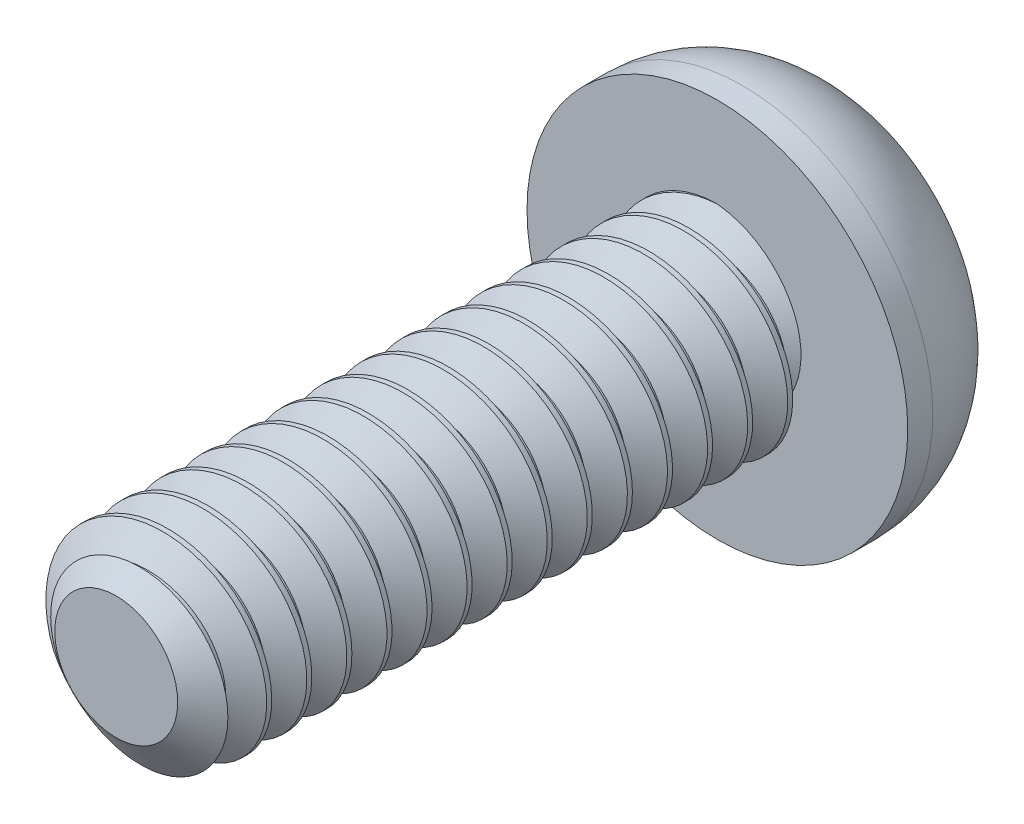
from build123d import *

# Parameters (mm, degrees)
SKETCH1_R          = 2
EXTRUDE1_DEPTH     = 12
CUT_SWEEP1_PITCH   = 0.8
SKETCH6_R          = 3.8
EXTRUDE2_DEPTH     = 2.75
CUT_EXTRUDE1_DEPTH = 2.25
SKETCH8_R          = 1.732050808
CUT_EXTRUDE2_DEPTH = 16.698487331
CUT_EXTRUDE2_TAPER = 45


with BuildPart() as part:
    # Sketch1 → Extrude1 (new body)
    with BuildSketch(Plane.XY):
        Circle(SKETCH1_R)
    extrude(amount=-EXTRUDE1_DEPTH)

    # Cut-Sweep1: the profile of Sketch3 profile screwed along a right-hand helix of 16 turns, 6 arcs to a turn; built about Z, then put on its axis
    cut_sweep1_z = Axis((0, 0, 0), (0, 0, 1))
    cut_sweep1_corners = [(2.0003, 0, -0.700173205), (1.480384758, 0, -0.4), (1.480384758, 0, -0.3), (2.0003, 0, 0.000173205)]
    with BuildLine(mode=Mode.PRIVATE) as cut_sweep1_profile:
        Line(cut_sweep1_corners[0], cut_sweep1_corners[1])
        Line(cut_sweep1_corners[1], cut_sweep1_corners[2])
        Line(cut_sweep1_corners[2], cut_sweep1_corners[3])
        Line(cut_sweep1_corners[3], cut_sweep1_corners[0])
    cut_sweep1_cap = Face(cut_sweep1_profile.wire())
    cut_sweep1_turn_angles = [0, 30, 60, 90, 120, 150, 180, 210, 240, 270, 300, 330, 360]
    cut_sweep1_turn_weights = [1, 0.8660254037844387, 1, 0.8660254037844387, 1, 0.8660254037844387, 1, 0.8660254037844387, 1, 0.8660254037844387, 1, 0.8660254037844387, 1]
    cut_sweep1_turn_rails = [Edge.make_bspline([Vector(p[0], p[1], 0).rotate(cut_sweep1_z, cut_sweep1_turn_angles[k]) / cut_sweep1_turn_weights[k] + Vector(0, 0, p[2] + CUT_SWEEP1_PITCH * cut_sweep1_turn_angles[k] / 360) for k in range(13)], [0, 0, 0, 1, 1, 2, 2, 3, 3, 4, 4, 5, 5, 6, 6, 6], 2, cut_sweep1_turn_weights) for p in cut_sweep1_corners]
    cut_sweep1_turn_sides = [Face.make_surface_from_curves(cut_sweep1_turn_rails[p[0]], cut_sweep1_turn_rails[p[1]]) for p in [(0, 1), (1, 2), (2, 3), (3, 0)]]
    cut_sweep1 = Plane(origin=(0, 0, 0), x_dir=(0, 1, 0), z_dir=(0, 0, -1)) * Solid(Shell([*[p.moved(Location((0, 0, CUT_SWEEP1_PITCH * i))) for i in range(16) for p in cut_sweep1_turn_sides], cut_sweep1_cap, cut_sweep1_cap.rotate(cut_sweep1_z, 5760).moved(Location((0, 0, CUT_SWEEP1_PITCH * 5760 / 360)))]))
    add(cut_sweep1, mode=Mode.SUBTRACT)

    # Sketch4 → Cut-Revolve1 (revolve, cut)
    with BuildSketch(Plane(origin=(0, 0, 0), x_dir=(0, 0, -1), z_dir=(1, 0, 0)), mode=Mode.PRIVATE) as cut_revolve1_sk:
        Polygon((0.541691224, 2), (0, 1.226384758), (0, 2), align=None)
    revolve(cut_revolve1_sk.sketch.rotate(Axis((0, 0, 0), (0, 0, -1)), 260.438603256), axis=Axis((0, 0, 0), (0, 0, -1)), mode=Mode.SUBTRACT)

    # Sketch6 → Extrude2 (add)
    with BuildSketch(Plane(origin=(0, 0, -12), x_dir=(-1, 0, 0), z_dir=(0, 0, -1))):
        Circle(SKETCH6_R)
    extrude(amount=EXTRUDE2_DEPTH)

    # Sketch10 → Cut-Revolve2 (revolve, cut)
    with BuildSketch(Plane(origin=(0, 0, 0), x_dir=(0, 0, -1), z_dir=(1, 0, 0)), mode=Mode.PRIVATE) as cut_revolve2_sk:
        with BuildLine():
            Line((12.5, 3.8), (12.5, 4.3))
            Line((12.5, 4.3), (15.25, 4.3))
            Line((15.25, 4.3), (15.25, 1.5))
            Line((15.25, 1.5), (14.75, 1.5))
            ThreePointArc((14.75, 1.5), (14.093959833, 3.108765054), (12.5, 3.8))
        make_face()
    revolve(cut_revolve2_sk.sketch.rotate(Axis((0, 0, 0), (0, 0, -1)), 90), axis=Axis((0, 0, 0), (0, 0, -1)), mode=Mode.SUBTRACT)

    # Sketch7 → Cut-Extrude1 (cut)
    with BuildSketch(Plane(origin=(0, 0, -14.75), x_dir=(-1, 0, 0), z_dir=(0, 0, -1))):
        Polygon((0, 1.732050808), (-1.5, 0.866025404), (-1.5, -0.866025404), (0, -1.732050808), (1.5, -0.866025404), (1.5, 0.866025404), align=None)
    extrude(amount=-CUT_EXTRUDE1_DEPTH, mode=Mode.SUBTRACT)

    # Sketch8 → Cut-Extrude2 (cut, through all)
    with BuildSketch(Plane.XY.offset(-14.75)):
        Circle(SKETCH8_R)
    extrude(amount=CUT_EXTRUDE2_DEPTH, taper=CUT_EXTRUDE2_TAPER, mode=Mode.SUBTRACT)


solid = part.part
